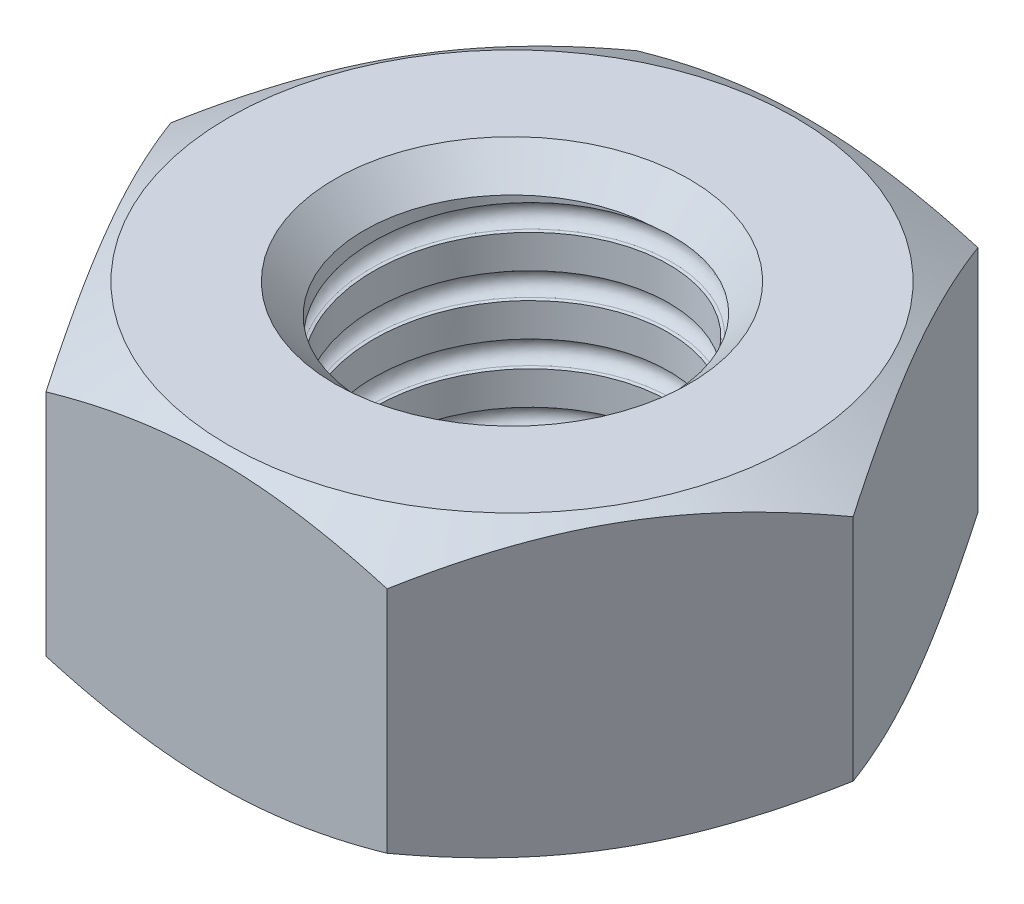
from build123d import *

# Parameters (mm, degrees)
EXTRUDE_1_DEPTH     = 5
SKETCH_2_OUTSIDE_W  = 27.154
SKETCH_2_OUTSIDE_H  = 25.606
SKETCH_2_OUTSIDE_R  = 4.8
CUT_EXTRUDE_7_DEPTH = 3
CUT_EXTRUDE_7_DRAFT = -60
SKETCH_3_OUTSIDE_W  = 27.154
SKETCH_3_OUTSIDE_H  = 25.606
SKETCH_3_OUTSIDE_R  = 4.8
CUT_EXTRUDE_8_DEPTH = 3
CUT_EXTRUDE_8_DRAFT = -60
SKETCH_4_R          = 2.5
CUT_EXTRUDE_9_DEPTH = 5
CHAMFER_1_SIZE      = 0.5
SWEEP_2_PITCH       = 1


with BuildPart() as part:
    # Эскиз1 → Бобышка-Вытянуть1 (new body)
    with BuildSketch(Plane(origin=(0, 0, 0), x_dir=(1, 0, 0), z_dir=(0, 1, 0))):
        Polygon((5.773502692, 0), (2.886751346, 5), (-2.886751346, 5), (-5.773502692, 0), (-2.886751346, -5), (2.886751346, -5), align=None)
    extrude(amount=EXTRUDE_1_DEPTH)


with BuildPart() as cut_extrude_7_tool:
    # Эскиз2 outside → Вырез-Вытянуть7 (with draft: the straight prism first)
    with BuildSketch(Plane(origin=(0, 5, 0), x_dir=(1, 0, 0), z_dir=(0, 1, 0))):
        Rectangle(SKETCH_2_OUTSIDE_W, SKETCH_2_OUTSIDE_H)
        Circle(SKETCH_2_OUTSIDE_R, mode=Mode.SUBTRACT)
    extrude(amount=-CUT_EXTRUDE_7_DEPTH)
    # Вырез-Вытянуть7: the draft: its side faces are tilted about the plane it starts from
    cut_extrude_7_sides = [cut_extrude_7_tool.faces().sort_by_distance(p)[0] for p in [
        (0, 3.5, 12.803),
        (13.577, 3.5, 0),
        (0, 3.5, -12.803),
        (-13.577, 3.5, 0),
        (-4.8, 3.5, 0),
    ]]
    draft(cut_extrude_7_sides, Plane(origin=(0, 5, 0), x_dir=(1, 0, 0), z_dir=(0, 1, 0)), CUT_EXTRUDE_7_DRAFT)


with BuildPart() as part_1:
    add(part.part)

    # Вырез-Вытянуть7: cut by cut_extrude_7_tool
    add(cut_extrude_7_tool.part, mode=Mode.SUBTRACT)


with BuildPart() as cut_extrude_8_tool:
    # Эскиз3 outside → Вырез-Вытянуть8 (with draft: the straight prism first)
    with BuildSketch(Plane.XZ):
        Rectangle(SKETCH_3_OUTSIDE_W, SKETCH_3_OUTSIDE_H)
        Circle(SKETCH_3_OUTSIDE_R, mode=Mode.SUBTRACT)
    extrude(amount=-CUT_EXTRUDE_8_DEPTH)
    # Вырез-Вытянуть8: the draft: its side faces are tilted about the plane it starts from
    cut_extrude_8_sides = [cut_extrude_8_tool.faces().sort_by_distance(p)[0] for p in [
        (0, 1.5, -12.803),
        (13.577, 1.5, 0),
        (0, 1.5, 12.803),
        (-13.577, 1.5, 0),
        (-4.8, 1.5, 0),
    ]]
    draft(cut_extrude_8_sides, Plane.XZ, CUT_EXTRUDE_8_DRAFT)


with BuildPart() as part_2:
    add(part_1.part)

    # Вырез-Вытянуть8: cut by cut_extrude_8_tool
    add(cut_extrude_8_tool.part, mode=Mode.SUBTRACT)

    # Эскиз4 → Вырез-Вытянуть9 (cut)
    with BuildSketch(Plane.XZ):
        with Locations(Location((0, 0, 0), (0, 0, 270))):
            Circle(SKETCH_4_R)
    extrude(amount=-CUT_EXTRUDE_9_DEPTH, mode=Mode.SUBTRACT)

    # Фаска1
    chamfer_1_edges = [part_2.edges().sort_by_distance(p)[0] for p in [
        (0, 5, 2.5),
        (0, 0, 2.5),
    ]]
    chamfer(chamfer_1_edges, length=CHAMFER_1_SIZE)

    # Вырез-По траектории2: arcs per turn and ends read off the stored shape
    # Вырез-По траектории2: the profile of Эскиз5 screwed along a left-hand helix through 6 turns, 8 arcs to a turn; built about Z, then put on its axis
    sweep_2_z = Axis((0, 0, 0), (0, 0, 1))
    sweep_2_corners = [(2.094441244, 0, 0.154640858), (2.094441244, 0, -0.577914284), (2.544944262, 0, -0.413944595), (2.686601766, 0, -0.211636713), (2.544944262, 0, -0.00932883)]
    with BuildLine(mode=Mode.PRIVATE) as sweep_2_profile:
        Line(sweep_2_corners[0], sweep_2_corners[1])
        Line(sweep_2_corners[1], sweep_2_corners[2])
        Line(sweep_2_corners[4], sweep_2_corners[0])
        ThreePointArc((2.544944262, 0, -0.413944595), (2.647666729, 0, -0.335122874), (2.686601766, 0, -0.211636713))
        ThreePointArc((2.686601766, 0, -0.211636713), (2.647666729, 0, -0.088150552), (2.544944262, 0, -0.00932883))
    sweep_2_cap = Face(sweep_2_profile.wire())
    sweep_2_arcs = [((2.544944262, 0, -0.413944595), (2.686601766, 0, -0.36238548), (2.686601766, 0, -0.211636713), (1, 0.8191520442889921, 1)), ((2.686601766, 0, -0.211636713), (2.686601766, 0, -0.060887945), (2.544944262, 0, -0.00932883), (1, 0.8191520442889921, 1))]  # start, shoulder, end, weights
    sweep_2_turn_angles = [0, -22.5, -45, -67.5, -90, -112.5, -135, -157.5, -180, -202.5, -225, -247.5, -270, -292.5, -315, -337.5, -360]
    sweep_2_turn_weights = [1, 0.9238795325112867, 1, 0.9238795325112867, 1, 0.9238795325112867, 1, 0.9238795325112867, 1, 0.9238795325112867, 1, 0.9238795325112867, 1, 0.9238795325112867, 1, 0.9238795325112867, 1]
    sweep_2_turn_rails = [Edge.make_bspline([Vector(p[0], p[1], 0).rotate(sweep_2_z, sweep_2_turn_angles[k]) / sweep_2_turn_weights[k] + Vector(0, 0, p[2] + -SWEEP_2_PITCH * sweep_2_turn_angles[k] / 360) for k in range(17)], [0, 0, 0, 1, 1, 2, 2, 3, 3, 4, 4, 5, 5, 6, 6, 7, 7, 8, 8, 8], 2, sweep_2_turn_weights) for p in sweep_2_corners]
    sweep_2_turn_sides = [*[Face.make_surface_from_curves(sweep_2_turn_rails[p[0]], sweep_2_turn_rails[p[1]]) for p in [(0, 1), (1, 2), (4, 0)]], *[Face.make_bezier_surface([[Vector(p[j][0], p[j][1], 0).rotate(sweep_2_z, sweep_2_turn_angles[2 * i + k]) / sweep_2_turn_weights[2 * i + k] + Vector(0, 0, p[j][2] + -SWEEP_2_PITCH * sweep_2_turn_angles[2 * i + k] / 360) for k in range(3)] for j in range(3)], [[p[3][j] * sweep_2_turn_weights[2 * i + k] for k in range(3)] for j in range(3)]) for p in sweep_2_arcs for i in range(8)]]
    sweep_2 = Plane(origin=(0, 0, 0), x_dir=(0, 0, 1), z_dir=(0, 1, 0)) * Solid(Shell([*[p.moved(Location((0, 0, SWEEP_2_PITCH * i))) for i in range(6) for p in sweep_2_turn_sides], sweep_2_cap, sweep_2_cap.rotate(sweep_2_z, -2160).moved(Location((0, 0, -SWEEP_2_PITCH * -2160 / 360)))]))
    add(sweep_2, mode=Mode.SUBTRACT)


solid = part_2.part
